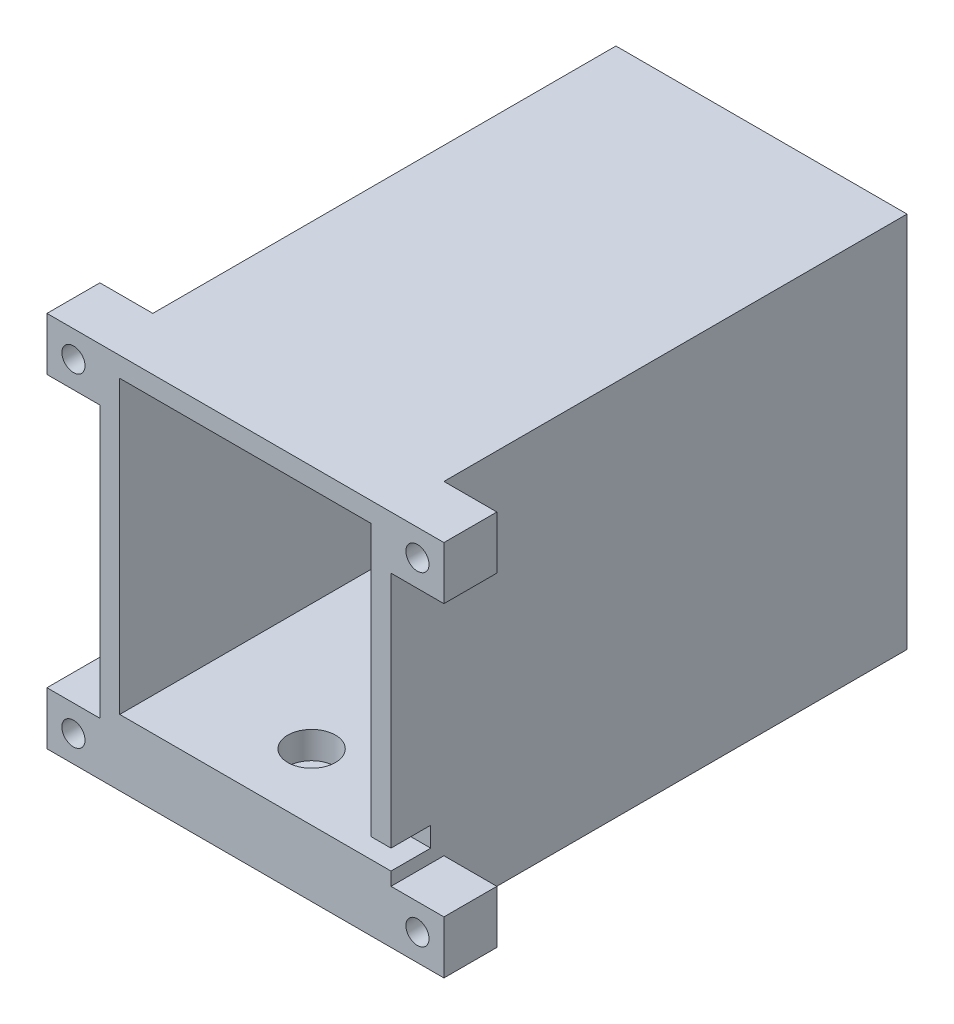
from build123d import *

# Parameters (mm, degrees)
SKETCH_1_W                 = 44
SKETCH_1_H                 = 78
EXTRUDE_1_DEPTH            = 57
SHELL_1_T                  = -3
SHELL_1_THICKNESS_2_FACE_W = 75
SHELL_1_THICKNESS_2_FACE_H = 38
SHELL_1_THICKNESS_2_DEPTH  = 7
SKETCH_3_R                 = 3.6
CUT_EXTRUDE_1_DEPTH        = 4.1
CUT_EXTRUDE_2_REACH        = 66.915
SKETCH_4_R                 = 2.25
SKETCH_5_W                 = 3
SKETCH_5_H                 = 3
CUT_EXTRUDE_3_DEPTH        = 6
SKETCH_6_W                 = 8
SKETCH_6_H                 = 8
SKETCH_6_R                 = 1.75
EXTRUDE_2_DEPTH            = 8
CUT_EXTRUDE_4_DEPTH        = 2.6


with BuildPart() as part:
    # 草圖1 → 填料-伸長1 (new body)
    with BuildSketch(Plane(origin=(0, 0, 0), x_dir=(1, 0, 0), z_dir=(0, 1, 0))):
        Rectangle(SKETCH_1_W, SKETCH_1_H)
    extrude(amount=EXTRUDE_1_DEPTH)

    # 薄殼1
    shell_1_openings = [part.faces().sort_by_distance(p)[0] for p in [
        (0, 28.5, 39),
    ]]
    offset(amount=SHELL_1_T, openings=shell_1_openings, kind=Kind.INTERSECTION)

    # 薄殼1 thickness 2 face (on inner face of the shell) → 薄殼1 thickness 2 (add)
    with BuildSketch(Plane(origin=(0, 3, 1.5), x_dir=(0, 0, -1), z_dir=(0, -1, 0))):
        Rectangle(SHELL_1_THICKNESS_2_FACE_W, SHELL_1_THICKNESS_2_FACE_H)
    extrude(amount=-SHELL_1_THICKNESS_2_DEPTH)

    # 草圖3 → 除料-伸長1 (cut)
    with BuildSketch(Plane(origin=(0, 10, 0), x_dir=(1, 0, 0), z_dir=(0, 1, 0))):
        with Locations((0, 25)):
            Circle(SKETCH_3_R)
        with Locations((0, -29)):
            Circle(SKETCH_3_R)
    extrude(amount=-CUT_EXTRUDE_1_DEPTH, mode=Mode.SUBTRACT)

    # 草圖4 → 除料-伸長2 (cut, up to next)
    with BuildSketch(Plane(origin=(0, 10, 0), x_dir=(1, 0, 0), z_dir=(0, 1, 0)), mode=Mode.PRIVATE) as cut_extrude_2_sk1:
        with Locations((0, 25)):
            Circle(SKETCH_4_R)
    cut_extrude_2_tool1 = extrude(cut_extrude_2_sk1.sketch, amount=-CUT_EXTRUDE_2_REACH, mode=Mode.PRIVATE) & part.part
    # 草圖4 → 除料-伸長2 (cut, up to next)
    with BuildSketch(Plane(origin=(0, 10, 0), x_dir=(1, 0, 0), z_dir=(0, 1, 0)), mode=Mode.PRIVATE) as cut_extrude_2_sk2:
        with Locations((0, -29)):
            Circle(SKETCH_4_R)
    cut_extrude_2_tool2 = extrude(cut_extrude_2_sk2.sketch, amount=-CUT_EXTRUDE_2_REACH, mode=Mode.PRIVATE) & part.part
    add(cut_extrude_2_tool1.solids().sort_by_distance((0, 10, -25))[0], mode=Mode.SUBTRACT)
    add(cut_extrude_2_tool2.solids().sort_by_distance((0, 10, 29))[0], mode=Mode.SUBTRACT)

    # 草圖5 → 除料-伸長3 (cut)
    with BuildSketch(Plane.XY.offset(39)):
        with Locations((20.5, 11.5)):
            Rectangle(SKETCH_5_W, SKETCH_5_H)
    extrude(amount=-CUT_EXTRUDE_3_DEPTH, mode=Mode.SUBTRACT)

    # 草圖6 → 填料-伸長2 (add)
    # profile 1 of 4: a face of its own
    with BuildSketch(Plane.XY.offset(39)):
        with Locations((-26, 53)):
            Rectangle(SKETCH_6_W, SKETCH_6_H)
        with Locations((-26, 53)):
            Circle(SKETCH_6_R, mode=Mode.SUBTRACT)
    # profile 2 of 4: a face of its own
    with BuildSketch(Plane.XY.offset(39)):
        with Locations((-26, 4)):
            Rectangle(SKETCH_6_W, SKETCH_6_H)
        with Locations((-26, 4)):
            Circle(SKETCH_6_R, mode=Mode.SUBTRACT)
    # profile 3 of 4: a face of its own
    with BuildSketch(Plane.XY.offset(39)):
        with Locations((26, 4)):
            Rectangle(SKETCH_6_W, SKETCH_6_H)
        with Locations((26, 4)):
            Circle(SKETCH_6_R, mode=Mode.SUBTRACT)
    # profile 4 of 4: a face of its own
    with BuildSketch(Plane.XY.offset(39)):
        with Locations((26, 53)):
            Rectangle(SKETCH_6_W, SKETCH_6_H)
        with Locations((26, 53)):
            Circle(SKETCH_6_R, mode=Mode.SUBTRACT)
    extrude(amount=-EXTRUDE_2_DEPTH)

    # 草圖7 → 除料-伸長4 (cut)
    with BuildSketch(Plane(origin=(0, 0, 31), x_dir=(-1, 0, 0), z_dir=(0, 0, -1))):
        Polygon((-22.824573519, 53), (-24.41228676, 55.75), (-27.58771324, 55.75), (-29.175426481, 53), (-27.58771324, 50.25), (-24.41228676, 50.25), align=None)
        Polygon((-22.824573519, 4), (-24.41228676, 6.75), (-27.58771324, 6.75), (-29.175426481, 4), (-27.58771324, 1.25), (-24.41228676, 1.25), align=None)
        Polygon((24.41228676, 1.25), (22.824573519, 4), (24.41228676, 6.75), (27.58771324, 6.75), (29.175426481, 4), (27.58771324, 1.25), align=None)
        Polygon((24.41228676, 50.25), (22.824573519, 53), (24.41228676, 55.75), (27.58771324, 55.75), (29.175426481, 53), (27.58771324, 50.25), align=None)
    extrude(amount=-CUT_EXTRUDE_4_DEPTH, mode=Mode.SUBTRACT)


solid = part.part
